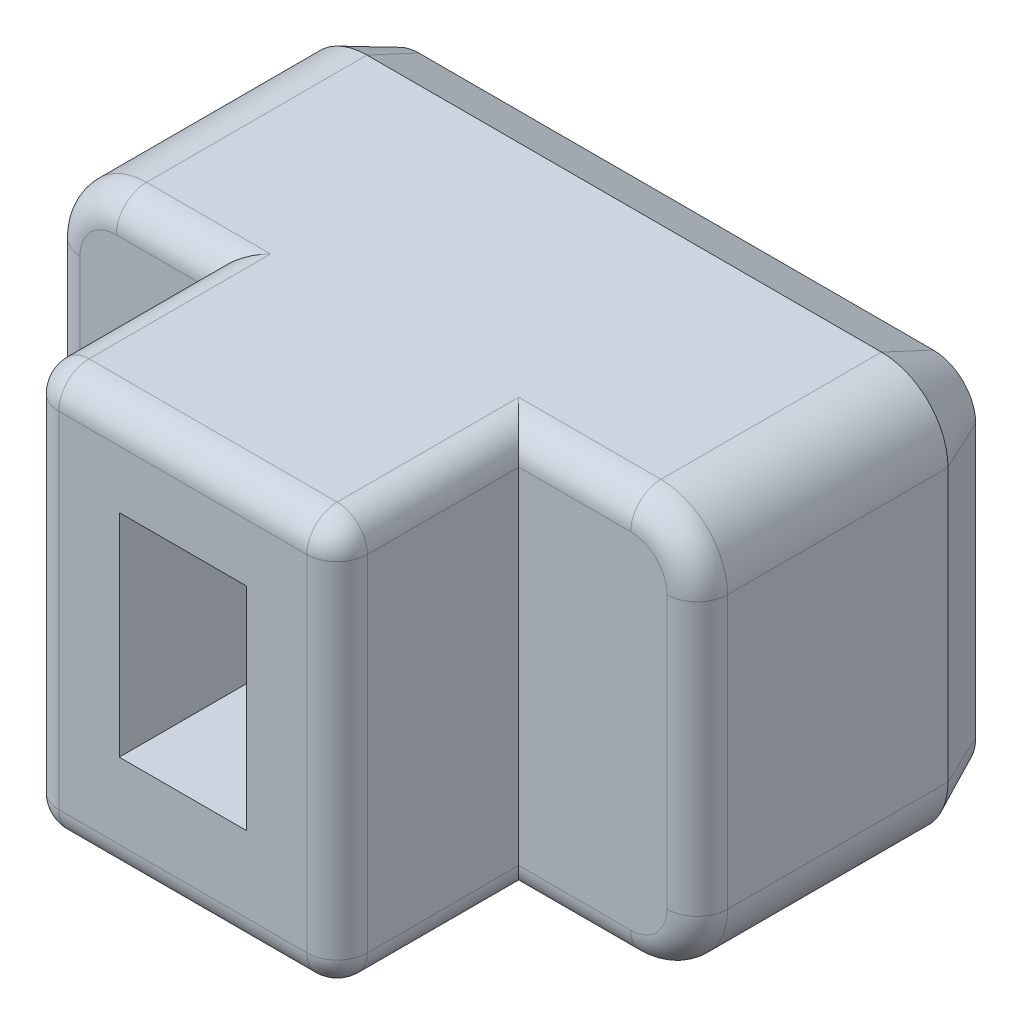
from build123d import *

# Parameters (mm, degrees)
BOSS_EXTRU_1_DEPTH      = 8
ESQUISSE3_W             = 2.1
ESQUISSE3_H             = 3.5
ENL_V_MAT_EXTRU_1_DEPTH = 3
ESQUISSE4_OUTSIDE_W     = 15.69
ESQUISSE4_OUTSIDE_H     = 11.69
ESQUISSE4_OUTSIDE_W_2   = 5.1
ESQUISSE4_OUTSIDE_H_2   = 6.7
ENL_V_MAT_EXTRU_2_DEPTH = 3
CONG_1_R                = 0.5
CHANFREIN1_SIZE         = 0.4
CHANFREIN1_SIZE2        = 0.857802768
ENL_V_MAT_EXTRU_3_DEPTH = 0.2
BOSS_EXTRU_2_DEPTH      = 0.2
BOSS_EXTRU_2_2_DEPTH    = 0.2
BOSS_EXTRU_2_3_DEPTH    = 0.2
BOSS_EXTRU_2_4_DEPTH    = 0.2


with BuildPart() as part:
    # Esquisse2 → Boss.-Extru.1 (new body)
    with BuildSketch(Plane.XY):
        with BuildLine():
            Line((1.1, 0), (9.6, 0))
            ThreePointArc((9.6, 0), (10.377817459, 0.322182541), (10.7, 1.1))
            Line((10.7, 1.1), (10.7, 5.6))
            ThreePointArc((10.7, 5.6), (10.377817459, 6.377817459), (9.6, 6.7))
            Line((9.6, 6.7), (1.1, 6.7))
            ThreePointArc((1.1, 6.7), (0.322182541, 6.377817459), (0, 5.6))
            Line((0, 5.6), (0, 1.1))
            ThreePointArc((0, 1.1), (0.322182541, 0.322182541), (1.1, 0))
        make_face()
    extrude(amount=BOSS_EXTRU_1_DEPTH)

    # Esquisse3 → Enlèv. mat.-Extru.1 (cut)
    with BuildSketch(Plane.XY.offset(8)):
        with Locations((5.2, 3.5)):
            Rectangle(ESQUISSE3_W, ESQUISSE3_H)
    extrude(amount=-ENL_V_MAT_EXTRU_1_DEPTH, mode=Mode.SUBTRACT)

    # Esquisse4 outside → Enlèv. mat.-Extru.2 (cut)
    with BuildSketch(Plane.XY.offset(8)):
        with Locations((5.35, 3.35)):
            Rectangle(ESQUISSE4_OUTSIDE_W, ESQUISSE4_OUTSIDE_H)
        with Locations((5.2, 3.35)):
            Rectangle(ESQUISSE4_OUTSIDE_W_2, ESQUISSE4_OUTSIDE_H_2, mode=Mode.SUBTRACT)
    extrude(amount=-ENL_V_MAT_EXTRU_2_DEPTH, mode=Mode.SUBTRACT)

    # Congé1
    cong_1_edges = [part.edges().sort_by_distance(p)[0] for p in [
        (8.675, 0, 5),
        (10.377817459, 0.322182541, 5),
        (10.7, 3.35, 5),
        (10.377817459, 6.377817459, 5),
        (1.875, 6.7, 5),
        (0.322182541, 6.377817459, 5),
        (1.875, 0, 5),
        (0.322182541, 0.322182541, 5),
        (7.75, 6.7, 6.5),
        (2.65, 6.7, 6.5),
        (7.75, 0, 6.5),
        (2.65, 0, 6.5),
        (2.65, 3.35, 8),
        (5.2, 6.7, 8),
        (7.75, 3.35, 8),
        (5.2, 0, 8),
        (8.675, 6.7, 5),
        (0, 3.35, 5),
    ]]
    fillet(cong_1_edges, radius=CONG_1_R)

    # Chanfrein1
    chanfrein1_edges = [part.edges().sort_by_distance(p)[0] for p in [
        (5.35, 0, 0),
        (10.377817459, 0.322182541, 0),
        (0.322182541, 0.322182541, 0),
        (10.7, 3.35, 0),
        (0, 3.35, 0),
        (10.377817459, 6.377817459, 0),
        (0.322182541, 6.377817459, 0),
        (5.35, 6.7, 0),
    ]]
    chanfrein1_side = [part.faces().sort_by_distance(p)[0] for p in [
        (5.35, 3.35, 0),
    ]]
    chamfer(chanfrein1_edges, length=CHANFREIN1_SIZE, length2=CHANFREIN1_SIZE2, reference=chanfrein1_side[0])

    # Esquisse5 → Enlèv. mat.-Extru.3 (cut)
    with BuildSketch(Plane.XY):
        with BuildLine():
            Line((2.132084919, 5.092998901), (1.977855513, 5.092998901))
            Line((1.977855513, 5.092998901), (1.283435672, 3.00276418))
            add(Edge.make_bspline(
                [(1.283435672, 3.00276418), (1.259169332, 2.929214015), (1.209812814, 2.779616669), (1.138903503, 2.549390234), (1.066558091, 2.310313962), (1.019727823, 2.147198821), (0.995902457, 2.064212364)],
                knots=[0, 0, 0, 0, 0.946717481, 1.92557585, 2.944615999, 4, 4, 4, 4], degree=3))
            Line((0.995902457, 2.064212364), (0.97885197, 2.064212364))
            add(Edge.make_bspline(
                [(0.97885197, 2.064212364), (0.983611741, 2.183296192), (0.992923109, 2.416255552), (1.000383125, 2.758101123), (1.007818828, 3.084368557), (1.008144131, 3.296751648), (1.008302811, 3.40035054)],
                knots=[0, 0, 0, 0, 1.070002705, 2.093207366, 3.069880747, 4, 4, 4, 4], degree=3))
            Line((1.008302811, 3.40035054), (1.008302811, 5.092998901))
            Line((1.008302811, 5.092998901), (0.672718223, 5.092998901))
            Line((0.672718223, 5.092998901), (0.672718223, 1.592998901))
            Line((0.672718223, 1.592998901), (1.156332041, 1.592998901))
            Line((1.156332041, 1.592998901), (1.805025575, 3.573180478))
            add(Edge.make_bspline(
                [(1.805025575, 3.573180478), (1.82401939, 3.632815092), (1.863747379, 3.757548504), (1.923178793, 3.953716097), (1.986009536, 4.166838966), (2.028100924, 4.314839859), (2.049932572, 4.391603861)],
                knots=[0, 0, 0, 0, 0.879089612, 1.838728189, 2.879007629, 4, 4, 4, 4], degree=3))
            Line((2.049932572, 4.391603861), (2.06000786, 4.391603861))
            add(Edge.make_bspline(
                [(2.06000786, 4.391603861), (2.07221962, 4.348739158), (2.095972387, 4.265364178), (2.129413264, 4.143607682), (2.163172943, 4.030210835), (2.193955452, 3.923812824), (2.224360774, 3.825595194), (2.251777436, 3.73434118), (2.27945464, 3.651494582), (2.296680691, 3.598508281), (2.304914857, 3.573180478)],
                knots=[0, 0, 0, 0, 1.252011101, 2.435253078, 3.546730711, 4.575481182, 5.546532985, 6.434881968, 7.251863215, 8, 8, 8, 8], degree=3))
            Line((2.304914857, 3.573180478), (2.953608391, 1.592998901))
            Line((2.953608391, 1.592998901), (3.437222209, 1.592998901))
            Line((3.437222209, 1.592998901), (3.437222209, 5.092998901))
            Line((3.437222209, 5.092998901), (3.101637621, 5.092998901))
            Line((3.101637621, 5.092998901), (3.101637621, 3.40035054))
            add(Edge.make_bspline(
                [(3.101637621, 3.40035054), (3.101904847, 3.298303791), (3.102455571, 3.087996266), (3.10821496, 2.763243502), (3.117623292, 2.419906089), (3.12600936, 2.184851955), (3.13031344, 2.064212364)],
                knots=[0, 0, 0, 0, 0.91621932, 1.888230822, 2.916151931, 4, 4, 4, 4], degree=3))
            Line((3.13031344, 2.064212364), (3.114037975, 2.064212364))
            add(Edge.make_bspline(
                [(3.114037975, 2.064212364), (3.089237016, 2.150832984), (3.041107414, 2.31893197), (2.966994546, 2.561739724), (2.897278311, 2.788484129), (2.848991203, 2.933098669), (2.825729738, 3.00276418)],
                knots=[0, 0, 0, 0, 1.101095622, 2.136824423, 3.102447933, 4, 4, 4, 4], degree=3))
            Line((2.825729738, 3.00276418), (2.132084919, 5.092998901))
        make_face()
        Polygon((3.984387842, 4.708587918), (5.396478188, 4.708587918), (5.396478188, 5.092998901), (3.648803254, 5.092998901), (3.648803254, 1.592998901), (5.319750996, 1.592998901), (5.319750996, 1.977409884), (3.984387842, 1.977409884), (3.984387842, 3.107392169), (5.171721766, 3.107392169), (5.171721766, 3.491803153), (3.984387842, 3.491803153), align=None)
        with BuildLine():
            add(Edge.make_bspline(
                [(6.89769608, 3.544504658), (6.982273878, 3.700734463), (7.152942017, 4.015988), (7.316072349, 4.335207542), (7.398360384, 4.49623185)],
                knots=[0, 0, 0, 0, 0.991137522, 2, 2, 2, 2], degree=3))
            Line((7.398360384, 4.49623185), (7.410760739, 4.49623185))
            add(Edge.make_bspline(
                [(7.410760739, 4.49623185), (7.40294553, 4.324464032), (7.387167715, 3.977688809), (7.384819859, 3.630561968), (7.383634964, 3.455377112)],
                knots=[0, 0, 0, 0, 0.990657967, 2, 2, 2, 2], degree=3))
            Line((7.383634964, 3.455377112), (7.383634964, 1.592998901))
            Line((7.383634964, 1.592998901), (7.719219552, 1.592998901))
            Line((7.719219552, 1.592998901), (7.719219552, 5.092998901))
            Line((7.719219552, 5.092998901), (7.38596003, 5.092998901))
            Line((7.38596003, 5.092998901), (6.30480414, 3.141493144))
            add(Edge.make_bspline(
                [(6.30480414, 3.141493144), (6.259121127, 3.058165059), (6.169437074, 2.894576895), (6.041302346, 2.652217847), (5.919839907, 2.418559727), (5.842720628, 2.265030003), (5.804914857, 2.189765951)],
                knots=[0, 0, 0, 0, 1.06068051, 2.082308496, 3.059900396, 4, 4, 4, 4], degree=3))
            Line((5.804914857, 2.189765951), (5.792514503, 2.189765951))
            add(Edge.make_bspline(
                [(5.792514503, 2.189765951), (5.796659439, 2.272682265), (5.805295294, 2.445436025), (5.813271391, 2.714674155), (5.819069712, 3.004030352), (5.819445877, 3.203491585), (5.819640278, 3.30657286)],
                knots=[0, 0, 0, 0, 0.891652168, 1.857731716, 2.89287886, 4, 4, 4, 4], degree=3))
            Line((5.819640278, 3.30657286), (5.819640278, 5.092998901))
            Line((5.819640278, 5.092998901), (5.48405569, 5.092998901))
            Line((5.48405569, 5.092998901), (5.48405569, 1.592998901))
            Line((5.48405569, 1.592998901), (5.817315212, 1.592998901))
            Line((5.817315212, 1.592998901), (6.89769608, 3.544504658))
        make_face()
        with BuildLine():
            add(Edge.make_bspline(
                [(8.978630535, 4.779114933), (9.002924072, 4.778371444), (9.050342747, 4.776920225), (9.119587959, 4.769946781), (9.184213647, 4.754526941), (9.244879609, 4.735220555), (9.301934596, 4.711665752), (9.353970762, 4.681031608), (9.40412624, 4.648630204), (9.463817309, 4.595961958), (9.531239939, 4.520400841), (9.596361885, 4.413657128), (9.646566013, 4.292463369), (9.669175482, 4.205920201), (9.680800597, 4.161422285)],
                knots=[0, 0, 0, 0, 0.855161278, 1.669193475, 2.443113935, 3.187599396, 3.908462251, 4.608569379, 5.309384162, 6.005408307, 7.402580701, 8.855494252, 10.383188878, 12, 12, 12, 12], degree=3))
            add(Edge.make_bspline(
                [(9.680800597, 4.161422285), (9.686928663, 4.131270503), (9.699843956, 4.067723684), (9.710573962, 3.968677432), (9.715363144, 3.86618989), (9.716610409, 3.797682833), (9.717226638, 3.763835925)],
                knots=[0, 0, 0, 0, 0.922650654, 1.944545568, 2.984472829, 4, 4, 4, 4], degree=3))
            Line((9.717226638, 3.763835925), (9.717226638, 1.592998901))
            Line((9.717226638, 1.592998901), (10.052811226, 1.592998901))
            Line((10.052811226, 1.592998901), (10.052811226, 3.753760637))
            add(Edge.make_bspline(
                [(10.052811226, 3.753760637), (10.052399909, 3.795624815), (10.051558826, 3.881231005), (10.043433878, 4.009707164), (10.031606468, 4.136401006), (10.017163687, 4.218587807), (10.010185008, 4.258300052)],
                knots=[0, 0, 0, 0, 0.990681078, 2.025799573, 3.04607637, 4, 4, 4, 4], degree=3))
            add(Edge.make_bspline(
                [(10.010185008, 4.258300052), (10.003072382, 4.290171561), (9.989032369, 4.35308453), (9.961657024, 4.444658305), (9.929926944, 4.532424811), (9.893505191, 4.616463583), (9.851987024, 4.696416249), (9.803992649, 4.7710997), (9.749247724, 4.839450709), (9.689327607, 4.90271645), (9.623493838, 4.960273737), (9.55085366, 5.011153385), (9.471428201, 5.054098881), (9.386368579, 5.091719195), (9.294277078, 5.122720686), (9.194216337, 5.142383616), (9.087022511, 5.156603617), (9.013042523, 5.157590181), (8.974755424, 5.158100761)],
                knots=[0, 0, 0, 0, 1.039001477, 2.050943637, 3.039263743, 4.007650631, 4.963814533, 5.903397847, 6.827895793, 7.746746442, 8.673325894, 9.60619446, 10.562888436, 11.542104156, 12.563884782, 13.647471358, 14.782488363, 16, 16, 16, 16], degree=3))
            add(Edge.make_bspline(
                [(8.974755424, 5.158100761), (8.938044295, 5.157373355), (8.866752241, 5.155960753), (8.763419062, 5.144611408), (8.66734194, 5.124077484), (8.577817859, 5.0970422), (8.494493453, 5.063247604), (8.418277895, 5.021372497), (8.347218522, 4.975160851), (8.282676314, 4.92221796), (8.224616259, 4.863351209), (8.17026664, 4.800766337), (8.123411449, 4.731322682), (8.067205839, 4.63189708), (8.007849352, 4.497076218), (7.977344207, 4.382536332), (7.961801483, 4.324176935)],
                knots=[0, 0, 0, 0, 1.073386452, 2.0844885, 3.034209312, 3.942307123, 4.8163, 5.657960766, 6.481387955, 7.291962494, 8.093225268, 8.897047994, 9.712151015, 10.537654773, 12.235895051, 14, 14, 14, 14], degree=3))
            add(Edge.make_bspline(
                [(7.961801483, 4.324176935), (7.952304873, 4.279084852), (7.932771661, 4.186336673), (7.916869853, 4.043389064), (7.905111868, 3.898371102), (7.904150007, 3.801578692), (7.903674822, 3.753760637)],
                knots=[0, 0, 0, 0, 0.962018654, 1.978739333, 3.001442831, 4, 4, 4, 4], degree=3))
            Line((7.903674822, 3.753760637), (7.903674822, 1.592998901))
            Line((7.903674822, 1.592998901), (8.23925941, 1.592998901))
            Line((8.23925941, 1.592998901), (8.23925941, 3.763835925))
            add(Edge.make_bspline(
                [(8.23925941, 3.763835925), (8.239726678, 3.803651898), (8.240675065, 3.884464249), (8.252572077, 4.004900212), (8.267374073, 4.122152792), (8.286102669, 4.19694799), (8.295061004, 4.232724322)],
                knots=[0, 0, 0, 0, 1.008737345, 2.047380225, 3.066015268, 4, 4, 4, 4], degree=3))
            add(Edge.make_bspline(
                [(8.295061004, 4.232724322), (8.307887231, 4.273202863), (8.332805243, 4.351842105), (8.387813266, 4.459538175), (8.454210553, 4.554158279), (8.519962566, 4.621570943), (8.578459003, 4.667599743), (8.625427309, 4.698025054), (8.676521841, 4.722468533), (8.730066128, 4.744136324), (8.787791118, 4.758904292), (8.848285396, 4.770808097), (8.91233037, 4.777859313), (8.956137798, 4.778688956), (8.978630535, 4.779114933)],
                knots=[0, 0, 0, 0, 1.60658962, 3.12118439, 4.560566694, 5.972564887, 6.669653074, 7.378327253, 8.087474445, 8.81271866, 9.563025653, 10.340486209, 11.147929752, 12, 12, 12, 12], degree=3))
        make_face()
    extrude(amount=ENL_V_MAT_EXTRU_3_DEPTH, mode=Mode.SUBTRACT)


with BuildPart() as body_2:
    # Esquisse5<4> → Boss.-Extru.2 (new body)
    with BuildSketch(Plane.XY):
        with BuildLine():
            Line((2.132084919, 5.092998901), (1.977855513, 5.092998901))
            Line((1.977855513, 5.092998901), (1.283435672, 3.00276418))
            add(Edge.make_bspline(
                [(1.283435672, 3.00276418), (1.259169332, 2.929214015), (1.209812814, 2.779616669), (1.138903503, 2.549390234), (1.066558091, 2.310313962), (1.019727823, 2.147198821), (0.995902457, 2.064212364)],
                knots=[0, 0, 0, 0, 0.946717481, 1.92557585, 2.944615999, 4, 4, 4, 4], degree=3))
            Line((0.995902457, 2.064212364), (0.97885197, 2.064212364))
            add(Edge.make_bspline(
                [(0.97885197, 2.064212364), (0.983611741, 2.183296192), (0.992923109, 2.416255552), (1.000383125, 2.758101123), (1.007818828, 3.084368557), (1.008144131, 3.296751648), (1.008302811, 3.40035054)],
                knots=[0, 0, 0, 0, 1.070002705, 2.093207366, 3.069880747, 4, 4, 4, 4], degree=3))
            Line((1.008302811, 3.40035054), (1.008302811, 5.092998901))
            Line((1.008302811, 5.092998901), (0.672718223, 5.092998901))
            Line((0.672718223, 5.092998901), (0.672718223, 1.592998901))
            Line((0.672718223, 1.592998901), (1.156332041, 1.592998901))
            Line((1.156332041, 1.592998901), (1.805025575, 3.573180478))
            add(Edge.make_bspline(
                [(1.805025575, 3.573180478), (1.82401939, 3.632815092), (1.863747379, 3.757548504), (1.923178793, 3.953716097), (1.986009536, 4.166838966), (2.028100924, 4.314839859), (2.049932572, 4.391603861)],
                knots=[0, 0, 0, 0, 0.879089612, 1.838728189, 2.879007629, 4, 4, 4, 4], degree=3))
            Line((2.049932572, 4.391603861), (2.06000786, 4.391603861))
            add(Edge.make_bspline(
                [(2.06000786, 4.391603861), (2.07221962, 4.348739158), (2.095972387, 4.265364178), (2.129413264, 4.143607682), (2.163172943, 4.030210835), (2.193955452, 3.923812824), (2.224360774, 3.825595194), (2.251777436, 3.73434118), (2.27945464, 3.651494582), (2.296680691, 3.598508281), (2.304914857, 3.573180478)],
                knots=[0, 0, 0, 0, 1.252011101, 2.435253078, 3.546730711, 4.575481182, 5.546532985, 6.434881968, 7.251863215, 8, 8, 8, 8], degree=3))
            Line((2.304914857, 3.573180478), (2.953608391, 1.592998901))
            Line((2.953608391, 1.592998901), (3.437222209, 1.592998901))
            Line((3.437222209, 1.592998901), (3.437222209, 5.092998901))
            Line((3.437222209, 5.092998901), (3.101637621, 5.092998901))
            Line((3.101637621, 5.092998901), (3.101637621, 3.40035054))
            add(Edge.make_bspline(
                [(3.101637621, 3.40035054), (3.101904847, 3.298303791), (3.102455571, 3.087996266), (3.10821496, 2.763243502), (3.117623292, 2.419906089), (3.12600936, 2.184851955), (3.13031344, 2.064212364)],
                knots=[0, 0, 0, 0, 0.91621932, 1.888230822, 2.916151931, 4, 4, 4, 4], degree=3))
            Line((3.13031344, 2.064212364), (3.114037975, 2.064212364))
            add(Edge.make_bspline(
                [(3.114037975, 2.064212364), (3.089237016, 2.150832984), (3.041107414, 2.31893197), (2.966994546, 2.561739724), (2.897278311, 2.788484129), (2.848991203, 2.933098669), (2.825729738, 3.00276418)],
                knots=[0, 0, 0, 0, 1.101095622, 2.136824423, 3.102447933, 4, 4, 4, 4], degree=3))
            Line((2.825729738, 3.00276418), (2.132084919, 5.092998901))
        make_face()
    extrude(amount=-BOSS_EXTRU_2_DEPTH)


with BuildPart() as body_3:
    # Esquisse5<4> → Boss.-Extru.2 2 (new body)
    with BuildSketch(Plane.XY):
        Polygon((3.984387842, 4.708587918), (5.396478188, 4.708587918), (5.396478188, 5.092998901), (3.648803254, 5.092998901), (3.648803254, 1.592998901), (5.319750996, 1.592998901), (5.319750996, 1.977409884), (3.984387842, 1.977409884), (3.984387842, 3.107392169), (5.171721766, 3.107392169), (5.171721766, 3.491803153), (3.984387842, 3.491803153), align=None)
    extrude(amount=-BOSS_EXTRU_2_2_DEPTH)


with BuildPart() as body_4:
    # Esquisse5<4> → Boss.-Extru.2 3 (new body)
    with BuildSketch(Plane.XY):
        with BuildLine():
            add(Edge.make_bspline(
                [(6.89769608, 3.544504658), (6.982273878, 3.700734463), (7.152942017, 4.015988), (7.316072349, 4.335207542), (7.398360384, 4.49623185)],
                knots=[0, 0, 0, 0, 0.991137522, 2, 2, 2, 2], degree=3))
            Line((7.398360384, 4.49623185), (7.410760739, 4.49623185))
            add(Edge.make_bspline(
                [(7.410760739, 4.49623185), (7.40294553, 4.324464032), (7.387167715, 3.977688809), (7.384819859, 3.630561968), (7.383634964, 3.455377112)],
                knots=[0, 0, 0, 0, 0.990657967, 2, 2, 2, 2], degree=3))
            Line((7.383634964, 3.455377112), (7.383634964, 1.592998901))
            Line((7.383634964, 1.592998901), (7.719219552, 1.592998901))
            Line((7.719219552, 1.592998901), (7.719219552, 5.092998901))
            Line((7.719219552, 5.092998901), (7.38596003, 5.092998901))
            Line((7.38596003, 5.092998901), (6.30480414, 3.141493144))
            add(Edge.make_bspline(
                [(6.30480414, 3.141493144), (6.259121127, 3.058165059), (6.169437074, 2.894576895), (6.041302346, 2.652217847), (5.919839907, 2.418559727), (5.842720628, 2.265030003), (5.804914857, 2.189765951)],
                knots=[0, 0, 0, 0, 1.06068051, 2.082308496, 3.059900396, 4, 4, 4, 4], degree=3))
            Line((5.804914857, 2.189765951), (5.792514503, 2.189765951))
            add(Edge.make_bspline(
                [(5.792514503, 2.189765951), (5.796659439, 2.272682265), (5.805295294, 2.445436025), (5.813271391, 2.714674155), (5.819069712, 3.004030352), (5.819445877, 3.203491585), (5.819640278, 3.30657286)],
                knots=[0, 0, 0, 0, 0.891652168, 1.857731716, 2.89287886, 4, 4, 4, 4], degree=3))
            Line((5.819640278, 3.30657286), (5.819640278, 5.092998901))
            Line((5.819640278, 5.092998901), (5.48405569, 5.092998901))
            Line((5.48405569, 5.092998901), (5.48405569, 1.592998901))
            Line((5.48405569, 1.592998901), (5.817315212, 1.592998901))
            Line((5.817315212, 1.592998901), (6.89769608, 3.544504658))
        make_face()
    extrude(amount=-BOSS_EXTRU_2_3_DEPTH)


with BuildPart() as body_5:
    # Esquisse5<4> → Boss.-Extru.2 4 (new body)
    with BuildSketch(Plane.XY):
        with BuildLine():
            add(Edge.make_bspline(
                [(8.978630535, 4.779114933), (9.002924072, 4.778371444), (9.050342747, 4.776920225), (9.119587959, 4.769946781), (9.184213647, 4.754526941), (9.244879609, 4.735220555), (9.301934596, 4.711665752), (9.353970762, 4.681031608), (9.40412624, 4.648630204), (9.463817309, 4.595961958), (9.531239939, 4.520400841), (9.596361885, 4.413657128), (9.646566013, 4.292463369), (9.669175482, 4.205920201), (9.680800597, 4.161422285)],
                knots=[0, 0, 0, 0, 0.855161278, 1.669193475, 2.443113935, 3.187599396, 3.908462251, 4.608569379, 5.309384162, 6.005408307, 7.402580701, 8.855494252, 10.383188878, 12, 12, 12, 12], degree=3))
            add(Edge.make_bspline(
                [(9.680800597, 4.161422285), (9.686928663, 4.131270503), (9.699843956, 4.067723684), (9.710573962, 3.968677432), (9.715363144, 3.86618989), (9.716610409, 3.797682833), (9.717226638, 3.763835925)],
                knots=[0, 0, 0, 0, 0.922650654, 1.944545568, 2.984472829, 4, 4, 4, 4], degree=3))
            Line((9.717226638, 3.763835925), (9.717226638, 1.592998901))
            Line((9.717226638, 1.592998901), (10.052811226, 1.592998901))
            Line((10.052811226, 1.592998901), (10.052811226, 3.753760637))
            add(Edge.make_bspline(
                [(10.052811226, 3.753760637), (10.052399909, 3.795624815), (10.051558826, 3.881231005), (10.043433878, 4.009707164), (10.031606468, 4.136401006), (10.017163687, 4.218587807), (10.010185008, 4.258300052)],
                knots=[0, 0, 0, 0, 0.990681078, 2.025799573, 3.04607637, 4, 4, 4, 4], degree=3))
            add(Edge.make_bspline(
                [(10.010185008, 4.258300052), (10.003072382, 4.290171561), (9.989032369, 4.35308453), (9.961657024, 4.444658305), (9.929926944, 4.532424811), (9.893505191, 4.616463583), (9.851987024, 4.696416249), (9.803992649, 4.7710997), (9.749247724, 4.839450709), (9.689327607, 4.90271645), (9.623493838, 4.960273737), (9.55085366, 5.011153385), (9.471428201, 5.054098881), (9.386368579, 5.091719195), (9.294277078, 5.122720686), (9.194216337, 5.142383616), (9.087022511, 5.156603617), (9.013042523, 5.157590181), (8.974755424, 5.158100761)],
                knots=[0, 0, 0, 0, 1.039001477, 2.050943637, 3.039263743, 4.007650631, 4.963814533, 5.903397847, 6.827895793, 7.746746442, 8.673325894, 9.60619446, 10.562888436, 11.542104156, 12.563884782, 13.647471358, 14.782488363, 16, 16, 16, 16], degree=3))
            add(Edge.make_bspline(
                [(8.974755424, 5.158100761), (8.938044295, 5.157373355), (8.866752241, 5.155960753), (8.763419062, 5.144611408), (8.66734194, 5.124077484), (8.577817859, 5.0970422), (8.494493453, 5.063247604), (8.418277895, 5.021372497), (8.347218522, 4.975160851), (8.282676314, 4.92221796), (8.224616259, 4.863351209), (8.17026664, 4.800766337), (8.123411449, 4.731322682), (8.067205839, 4.63189708), (8.007849352, 4.497076218), (7.977344207, 4.382536332), (7.961801483, 4.324176935)],
                knots=[0, 0, 0, 0, 1.073386452, 2.0844885, 3.034209312, 3.942307123, 4.8163, 5.657960766, 6.481387955, 7.291962494, 8.093225268, 8.897047994, 9.712151015, 10.537654773, 12.235895051, 14, 14, 14, 14], degree=3))
            add(Edge.make_bspline(
                [(7.961801483, 4.324176935), (7.952304873, 4.279084852), (7.932771661, 4.186336673), (7.916869853, 4.043389064), (7.905111868, 3.898371102), (7.904150007, 3.801578692), (7.903674822, 3.753760637)],
                knots=[0, 0, 0, 0, 0.962018654, 1.978739333, 3.001442831, 4, 4, 4, 4], degree=3))
            Line((7.903674822, 3.753760637), (7.903674822, 1.592998901))
            Line((7.903674822, 1.592998901), (8.23925941, 1.592998901))
            Line((8.23925941, 1.592998901), (8.23925941, 3.763835925))
            add(Edge.make_bspline(
                [(8.23925941, 3.763835925), (8.239726678, 3.803651898), (8.240675065, 3.884464249), (8.252572077, 4.004900212), (8.267374073, 4.122152792), (8.286102669, 4.19694799), (8.295061004, 4.232724322)],
                knots=[0, 0, 0, 0, 1.008737345, 2.047380225, 3.066015268, 4, 4, 4, 4], degree=3))
            add(Edge.make_bspline(
                [(8.295061004, 4.232724322), (8.307887231, 4.273202863), (8.332805243, 4.351842105), (8.387813266, 4.459538175), (8.454210553, 4.554158279), (8.519962566, 4.621570943), (8.578459003, 4.667599743), (8.625427309, 4.698025054), (8.676521841, 4.722468533), (8.730066128, 4.744136324), (8.787791118, 4.758904292), (8.848285396, 4.770808097), (8.91233037, 4.777859313), (8.956137798, 4.778688956), (8.978630535, 4.779114933)],
                knots=[0, 0, 0, 0, 1.60658962, 3.12118439, 4.560566694, 5.972564887, 6.669653074, 7.378327253, 8.087474445, 8.81271866, 9.563025653, 10.340486209, 11.147929752, 12, 12, 12, 12], degree=3))
        make_face()
    extrude(amount=-BOSS_EXTRU_2_4_DEPTH)


solid = Compound([part.part, body_2.part, body_3.part, body_4.part, body_5.part])
